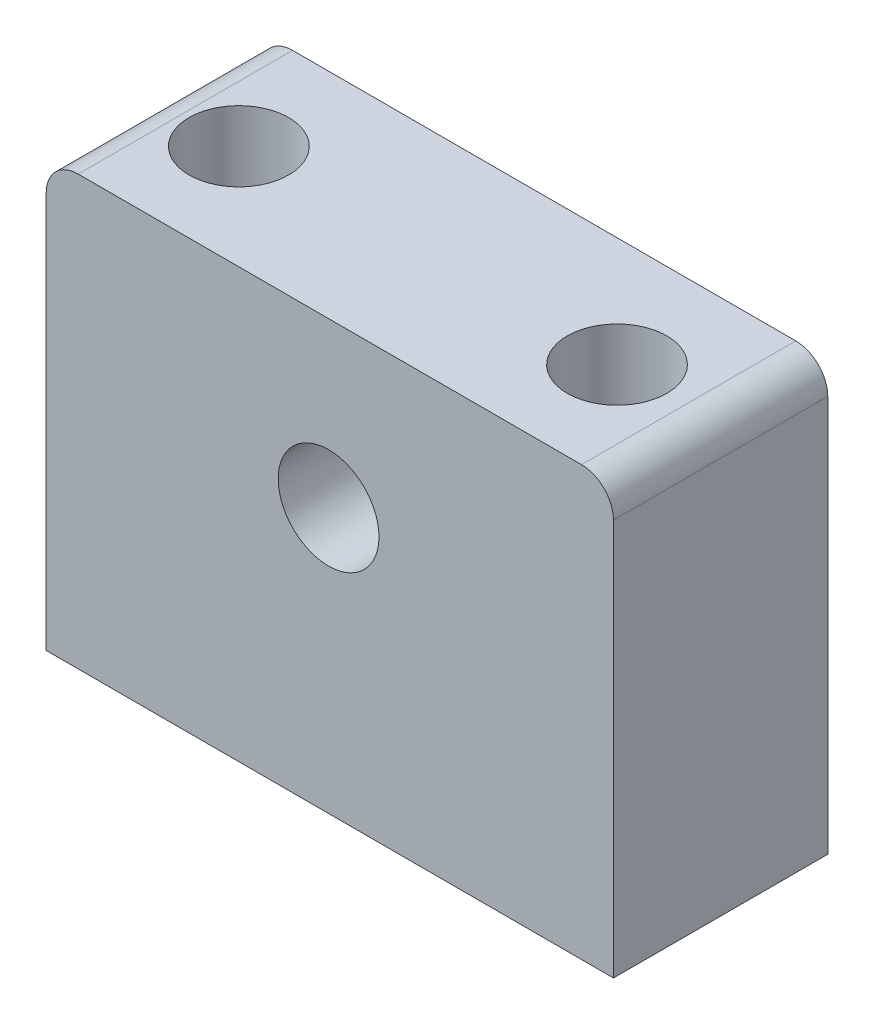
from build123d import *

# Parameters (mm, degrees)
SKETCH1_W           = 45
SKETCH1_H           = 34
SKETCH1_R           = 4
BOSS_EXTRUDE1_DEPTH = 17
SKETCH2_R           = 3.95
CUT_EXTRUDE1_DEPTH  = 17
FILLET1_R           = 2.54


with BuildPart() as part:
    # Sketch1 → Boss-Extrude1 (new body)
    with BuildSketch(Plane.XY):
        with Locations((22.5, 17)):
            Rectangle(SKETCH1_W, SKETCH1_H)
        with Locations((22.4, 21)):
            Circle(SKETCH1_R, mode=Mode.SUBTRACT)
    extrude(amount=BOSS_EXTRUDE1_DEPTH)

    # Sketch2 → Cut-Extrude1 (cut)
    with BuildSketch(Plane(origin=(0, 34, 0), x_dir=(1, 0, 0), z_dir=(0, 1, 0))):
        with Locations((7, -8.718619698)):
            Circle(SKETCH2_R)
        with Locations((37, -8.718619698)):
            Circle(SKETCH2_R)
    extrude(amount=-CUT_EXTRUDE1_DEPTH, mode=Mode.SUBTRACT)

    # Fillet1
    fillet1_edges = [part.edges().sort_by_distance(p)[0] for p in [
        (0, 34, 8.5),
        (45, 34, 8.5),
    ]]
    fillet(fillet1_edges, radius=FILLET1_R)


solid = part.part
